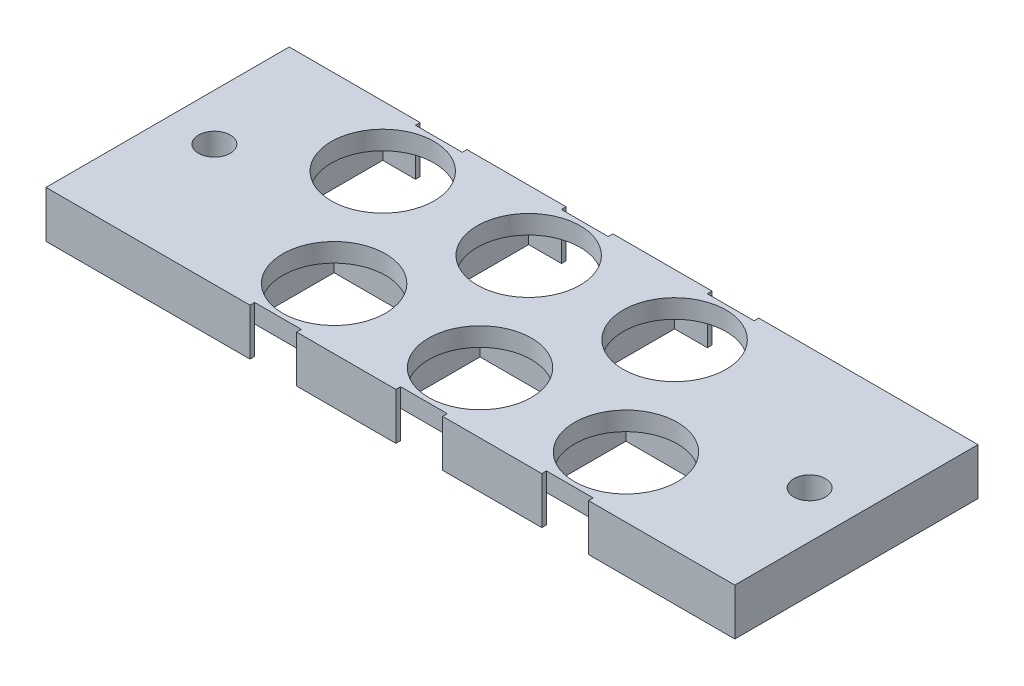
from build123d import *

# Parameters (mm, degrees)
SKETCH1_W             = 12
SKETCH1_H             = 12
SKETCH1_R             = 5.5
BOSS_EXTRUDE1_DEPTH   = 2
BOSS_EXTRUDE1_2_DEPTH = 2
BOSS_EXTRUDE1_3_DEPTH = 2
BOSS_EXTRUDE1_4_DEPTH = 2
BOSS_EXTRUDE1_5_DEPTH = 2
BOSS_EXTRUDE1_6_DEPTH = 2
SKETCH1_3_R           = 1.7
BOSS_EXTRUDE2_DEPTH   = 5
CUT_EXTRUDE1_DEPTH    = 1


with BuildPart() as part:
    # Sketch1 → Boss-Extrude1 (new body)
    with BuildSketch(Plane(origin=(0, 0, 0), x_dir=(1, 0, 0), z_dir=(0, 1, 0))):
        with Locations((-2.713611414, -10.664883528)):
            Rectangle(SKETCH1_W, SKETCH1_H)
        with Locations((-2.713611414, -10.664883528)):
            Circle(SKETCH1_R, mode=Mode.SUBTRACT)
    extrude(amount=-BOSS_EXTRUDE1_DEPTH)



with BuildPart() as body_2:
    # Sketch1 → Boss-Extrude1 2 (new body)
    with BuildSketch(Plane(origin=(0, 0, 0), x_dir=(1, 0, 0), z_dir=(0, 1, 0))):
        with Locations((12.886388586, -10.664882884)):
            Rectangle(SKETCH1_W, SKETCH1_H)
        with Locations((12.886388586, -10.664882884)):
            Circle(SKETCH1_R, mode=Mode.SUBTRACT)
    extrude(amount=-BOSS_EXTRUDE1_2_DEPTH)


with BuildPart() as body_3:
    # Sketch1 → Boss-Extrude1 3 (new body)
    with BuildSketch(Plane(origin=(0, 0, 0), x_dir=(1, 0, 0), z_dir=(0, 1, 0))):
        with Locations((5.086388588, -23.66488245)):
            Rectangle(SKETCH1_W, SKETCH1_H)
        with Locations((5.086388588, -23.66488245)):
            Circle(SKETCH1_R, mode=Mode.SUBTRACT)
    extrude(amount=-BOSS_EXTRUDE1_3_DEPTH)


with BuildPart() as body_4:
    # Sketch1 → Boss-Extrude1 4 (new body)
    with BuildSketch(Plane(origin=(0, 0, 0), x_dir=(1, 0, 0), z_dir=(0, 1, 0))):
        with Locations((20.686388588, -23.664882884)):
            Rectangle(SKETCH1_W, SKETCH1_H)
        with Locations((20.686388588, -23.664882884)):
            Circle(SKETCH1_R, mode=Mode.SUBTRACT)
    extrude(amount=-BOSS_EXTRUDE1_4_DEPTH)


with BuildPart() as body_5:
    # Sketch1 → Boss-Extrude1 5 (new body)
    with BuildSketch(Plane(origin=(0, 0, 0), x_dir=(1, 0, 0), z_dir=(0, 1, 0))):
        with Locations((28.486388586, -10.664882884)):
            Rectangle(SKETCH1_W, SKETCH1_H)
        with Locations((28.486388586, -10.664882884)):
            Circle(SKETCH1_R, mode=Mode.SUBTRACT)
    extrude(amount=-BOSS_EXTRUDE1_5_DEPTH)


with BuildPart() as body_6:
    # Sketch1 → Boss-Extrude1 6 (new body)
    with BuildSketch(Plane(origin=(0, 0, 0), x_dir=(1, 0, 0), z_dir=(0, 1, 0))):
        with Locations((36.286388588, -23.664883087)):
            Rectangle(SKETCH1_W, SKETCH1_H)
        with Locations((36.286388588, -23.664883087)):
            Circle(SKETCH1_R, mode=Mode.SUBTRACT)
    extrude(amount=-BOSS_EXTRUDE1_6_DEPTH)


with BuildPart() as part_1:
    add(part.part)

    add(body_2.part)  # Boss-Extrude2 merges body 2

    add(body_3.part)  # Boss-Extrude2 merges body 3

    add(body_4.part)  # Boss-Extrude2 merges body 4

    add(body_5.part)  # Boss-Extrude2 merges body 5

    add(body_6.part)  # Boss-Extrude2 merges body 6
    # Sketch1<3> → Boss-Extrude2 (add)
    with BuildSketch(Plane(origin=(0, 0, 0), x_dir=(1, 0, 0), z_dir=(0, 1, 0))):
        Polygon((6.386388586, -4.164882884), (3.786388586, -4.164883528), (-0.213611414, -4.164883528), (-0.213611414, -4.664883528), (3.286388586, -4.664883528), (3.286388586, -16.664883528), (-8.713611414, -16.664883528), (-8.713611414, -4.664883528), (-5.213611414, -4.664883528), (-5.213611414, -4.164883528), (-19.213611414, -4.164883528), (-19.213611414, -30.16488245), (2.586388588, -30.16488245), (2.586388588, -29.66488245), (-0.913611412, -29.66488245), (-0.913611412, -17.66488245), (11.086388588, -17.66488245), (11.086388588, -29.66488245), (7.586388588, -29.66488245), (7.586388588, -30.16488245), (11.586388588, -30.16488245), (14.186388588, -30.164882884), (18.186388588, -30.164882884), (18.186388588, -29.664882884), (14.686388588, -29.664882884), (14.686388588, -17.664882884), (26.686388588, -17.664882884), (26.686388588, -29.664882884), (23.186388588, -29.664882884), (23.186388588, -30.164882884), (27.186388588, -30.164882884), (29.786388588, -30.164883087), (33.786388588, -30.164883087), (33.786388588, -29.664883087), (30.286388588, -29.664883087), (30.286388588, -17.664883087), (42.286388588, -17.664883087), (42.286388588, -29.664883087), (38.786388588, -29.664883087), (38.786388588, -30.164883087), (42.786388588, -30.164883087), (54.418988347, -30.16488245), (54.418988347, -4.164883528), (34.986388586, -4.164882884), (30.986388586, -4.164882884), (30.986388586, -4.664882884), (34.486388586, -4.664882884), (34.486388586, -16.664882884), (22.486388586, -16.664882884), (22.486388586, -4.664882884), (25.986388586, -4.664882884), (25.986388586, -4.164882884), (15.386388586, -4.164882884), (15.386388586, -4.664882884), (18.886388586, -4.664882884), (18.886388586, -16.664882884), (6.886388586, -16.664882884), (6.886388586, -4.664882884), (10.386388586, -4.664882884), (10.386388586, -4.164882884), align=None)
        with Locations((-14.213611414, -17.164882989)):
            Circle(SKETCH1_3_R, mode=Mode.SUBTRACT)
        with Locations((49.418988347, -17.164882989)):
            Circle(SKETCH1_3_R, mode=Mode.SUBTRACT)
    extrude(amount=-BOSS_EXTRUDE2_DEPTH)

    # Sketch2 → Cut-Extrude1 (cut)
    with BuildSketch(Plane(origin=(0, -5, 0), x_dir=(-1, 0, 0), z_dir=(0, -1, 0))):
        Polygon((6.798219501, -22.292392997), (8.345014372, -22.292392997), (8.345014372, -22.618034023), (7.083155398, -22.618034023), (7.083155398, -23.5949571), (8.345014372, -23.5949571), (8.345014372, -23.920598125), (7.083155398, -23.920598125), (7.083155398, -25.467392997), (6.798219501, -25.467392997), align=None)
        with BuildLine():
            Line((10.624501552, -22.292392997), (10.624501552, -22.618034023))
            Line((10.624501552, -22.618034023), (9.545179637, -22.618034023))
            Line((9.545179637, -22.618034023), (9.373454877, -23.453125169))
            add(Edge.make_bspline(
                [(9.373454877, -23.453125169), (9.407069849, -23.443844851), (9.47219354, -23.425865702), (9.568314271, -23.405903325), (9.65956577, -23.393869672), (9.718779856, -23.392226555), (9.747433243, -23.391431459)],
                knots=[0, 0, 0, 0, 1.100273476, 2.13160584, 3.095893838, 4, 4, 4, 4], degree=3))
            add(Edge.make_bspline(
                [(9.747433243, -23.391431459), (9.782887778, -23.392198843), (9.852600253, -23.393707713), (9.95459844, -23.408196462), (10.051964708, -23.431001956), (10.144495429, -23.462861287), (10.232361786, -23.50360083), (10.314755359, -23.55449149), (10.392912895, -23.613939584), (10.465432248, -23.682288273), (10.531222156, -23.757510025), (10.589067018, -23.838388951), (10.638200225, -23.924139045), (10.677716053, -24.015579597), (10.709270413, -24.111699686), (10.73027258, -24.213510672), (10.744257737, -24.320052895), (10.745820188, -24.392900612), (10.746616936, -24.430048246)],
                knots=[0, 0, 0, 0, 1.052922333, 2.070308379, 3.05430497, 4.020497103, 4.973039431, 5.925935799, 6.892292201, 7.88610001, 8.88166317, 9.857072816, 10.836096531, 11.812156883, 12.81219415, 13.836441305, 14.89672472, 16, 16, 16, 16], degree=3))
            add(Edge.make_bspline(
                [(10.746616936, -24.430048246), (10.746013618, -24.455921974), (10.744815135, -24.50731977), (10.738720416, -24.583650581), (10.726985874, -24.658365436), (10.711230867, -24.731474249), (10.690781673, -24.802838608), (10.666026603, -24.87266278), (10.635731635, -24.940512173), (10.602501745, -25.007028781), (10.565085297, -25.070708856), (10.523557651, -25.130261865), (10.479683241, -25.186581177), (10.43247427, -25.239062778), (10.381491939, -25.287361801), (10.327353683, -25.331764885), (10.270491502, -25.373022949), (10.210025675, -25.409461241), (10.147303566, -25.442991922), (10.081419397, -25.470499703), (10.013872905, -25.495092824), (9.94369191, -25.514695753), (9.87103538, -25.530055999), (9.795783548, -25.540488687), (9.718331083, -25.548087312), (9.665830179, -25.548562979), (9.639310246, -25.548803254)],
                knots=[0, 0, 0, 0, 1.056347294, 2.098418968, 3.122841568, 4.141288669, 5.149314143, 6.15115421, 7.162517403, 8.180376062, 9.185164535, 10.17417709, 11.141909838, 12.097768115, 13.052685741, 14.0056014, 14.954263652, 15.917497458, 16.885230207, 17.854509472, 18.828990115, 19.81800267, 20.826176721, 21.857883937, 22.917946725, 24, 24, 24, 24], degree=3))
            add(Edge.make_bspline(
                [(9.639310246, -25.548803254), (9.607674382, -25.548176565), (9.545434557, -25.546943629), (9.454248042, -25.534045431), (9.366514079, -25.51557245), (9.282938915, -25.487780977), (9.202773555, -25.452958217), (9.127097232, -25.408947118), (9.053976278, -25.359073217), (8.986383216, -25.300217468), (8.923648742, -25.235886814), (8.867490695, -25.166075239), (8.817476664, -25.09193496), (8.774407565, -25.01310592), (8.737670075, -24.929795253), (8.708809335, -24.841690816), (8.685515399, -24.749252955), (8.675660725, -24.685613699), (8.670655398, -24.653290433)],
                knots=[0, 0, 0, 0, 1.0467383, 2.05933395, 3.04377827, 4.011590433, 4.970194871, 5.932262533, 6.905835911, 7.896367577, 8.894135286, 9.877477877, 10.858688626, 11.851381753, 12.8477658, 13.868841284, 14.917554742, 16, 16, 16, 16], degree=3))
            Line((8.670655398, -24.653290433), (8.955591295, -24.653290433))
            add(Edge.make_bspline(
                [(8.955591295, -24.653290433), (8.962602201, -24.683567644), (8.976077551, -24.741762123), (9.005655623, -24.823524126), (9.041819667, -24.896385136), (9.084822183, -24.961308972), (9.13612114, -25.017922848), (9.19465855, -25.068375469), (9.26028827, -25.113891479), (9.333216414, -25.151830703), (9.410153993, -25.184187358), (9.490678534, -25.205733539), (9.572597477, -25.220883634), (9.628004284, -25.22240016), (9.655846704, -25.223162228)],
                knots=[0, 0, 0, 0, 1.136247022, 2.183929868, 3.172523383, 4.106158343, 5.02341133, 5.958108904, 6.928429099, 7.938127109, 8.96079061, 9.975095812, 10.982467395, 12, 12, 12, 12], degree=3))
            add(Edge.make_bspline(
                [(9.655846704, -25.223162228), (9.683023293, -25.222417665), (9.736534219, -25.220951615), (9.815284548, -25.209667654), (9.891314798, -25.192289), (9.963874758, -25.166281346), (10.034234154, -25.134672208), (10.100613217, -25.094109247), (10.164932256, -25.047427659), (10.225192063, -24.993945573), (10.280382135, -24.935008778), (10.329146616, -24.871982857), (10.369765673, -24.804748289), (10.4039959, -24.734469072), (10.429988536, -24.660374952), (10.448531426, -24.582813172), (10.459419915, -24.501592154), (10.460917771, -24.446193566), (10.461681039, -24.417963911)],
                knots=[0, 0, 0, 0, 1.027316725, 2.022795036, 3.002884548, 3.971462791, 4.93288096, 5.914575861, 6.907176829, 7.935150275, 8.956128384, 9.956726525, 10.942570165, 11.921478529, 12.907843606, 13.90538589, 14.932640048, 16, 16, 16, 16], degree=3))
            add(Edge.make_bspline(
                [(10.461681039, -24.417963911), (10.461083704, -24.392495193), (10.459914506, -24.342643802), (10.450361774, -24.269710237), (10.433745664, -24.20070112), (10.410682573, -24.135283207), (10.381400448, -24.073394799), (10.345617007, -24.014972023), (10.302660711, -23.960784903), (10.25359164, -23.910808086), (10.199836132, -23.864684521), (10.140469308, -23.825365243), (10.076733517, -23.79228726), (10.009396666, -23.76374129), (9.93685708, -23.743239186), (9.860551277, -23.72784689), (9.779655264, -23.718942953), (9.72434614, -23.717707526), (9.695915815, -23.717072484)],
                knots=[0, 0, 0, 0, 1.045622112, 2.046656509, 3.013763289, 3.955457236, 4.890082067, 5.820317437, 6.762574623, 7.722996705, 8.69280354, 9.665887285, 10.63943826, 11.638615906, 12.663482002, 13.728887084, 14.832589034, 16, 16, 16, 16], degree=3))
            add(Edge.make_bspline(
                [(9.695915815, -23.717072484), (9.671306001, -23.717599164), (9.620492978, -23.718686622), (9.5425487, -23.726693516), (9.460641208, -23.73961059), (9.375084487, -23.757378115), (9.285621598, -23.780629163), (9.192441334, -23.808491603), (9.095347778, -23.841803701), (9.0299267, -23.866960781), (8.996296424, -23.879892997)],
                knots=[0, 0, 0, 0, 0.817624296, 1.688186739, 2.600797293, 3.572016777, 4.590301741, 5.671205678, 6.80286297, 8, 8, 8, 8], degree=3))
            Line((8.996296424, -23.879892997), (9.321937449, -22.292392997))
            Line((9.321937449, -22.292392997), (10.624501552, -22.292392997))
        make_face()
    extrude(amount=-CUT_EXTRUDE1_DEPTH, mode=Mode.SUBTRACT)


solid = part_1.part
